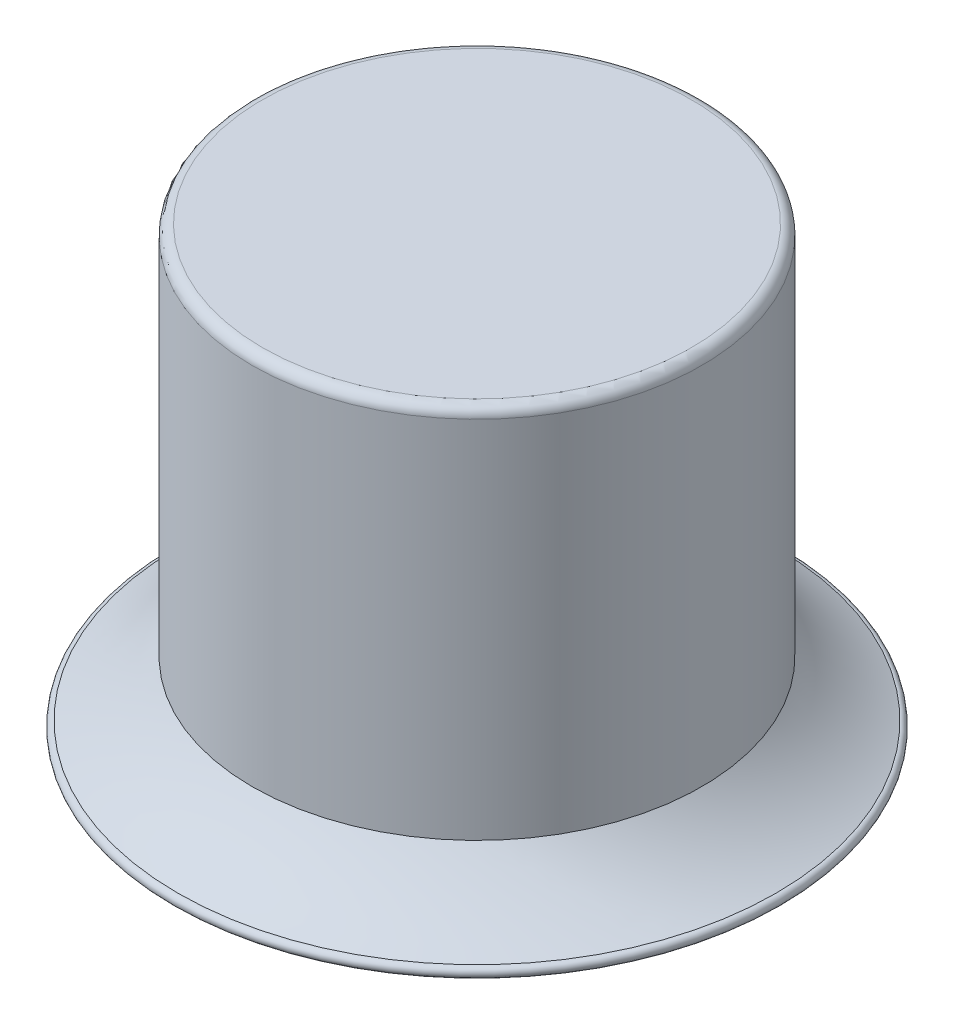
from build123d import *


with BuildPart() as part:
    # Sketch1 → Revolve1 (revolve)
    with BuildSketch(Plane(origin=(0, 0, 0), x_dir=(0, 0, -1), z_dir=(1, 0, 0))):
        with BuildLine():
            Line((21.420222956, 6.247571262), (21.420222956, 41.000550035))
            ThreePointArc((21.420222956, 41.000550035), (21.138958909, 41.695833164), (20.453385696, 42))
            Line((20.453385696, 42), (0, 42))
            Line((0, 42), (0, 41.000550035))
            Line((0, 41.000550035), (20.420222956, 41.000550035))
            Line((20.420222956, 41.000550035), (20.420222956, 5.958024521))
            ThreePointArc((20.420222956, 5.958024521), (24.090810346, 2.478196798), (28.5, 0))
            ThreePointArc((28.5, 0), (29, 0.5), (28.5, 1))
            ThreePointArc((28.5, 1), (24.684049336, 3.251335536), (21.420222956, 6.247571262))
        make_face()
    revolve(axis=Axis((0, 42, 0), (0, -1, 0)))


solid = part.part
